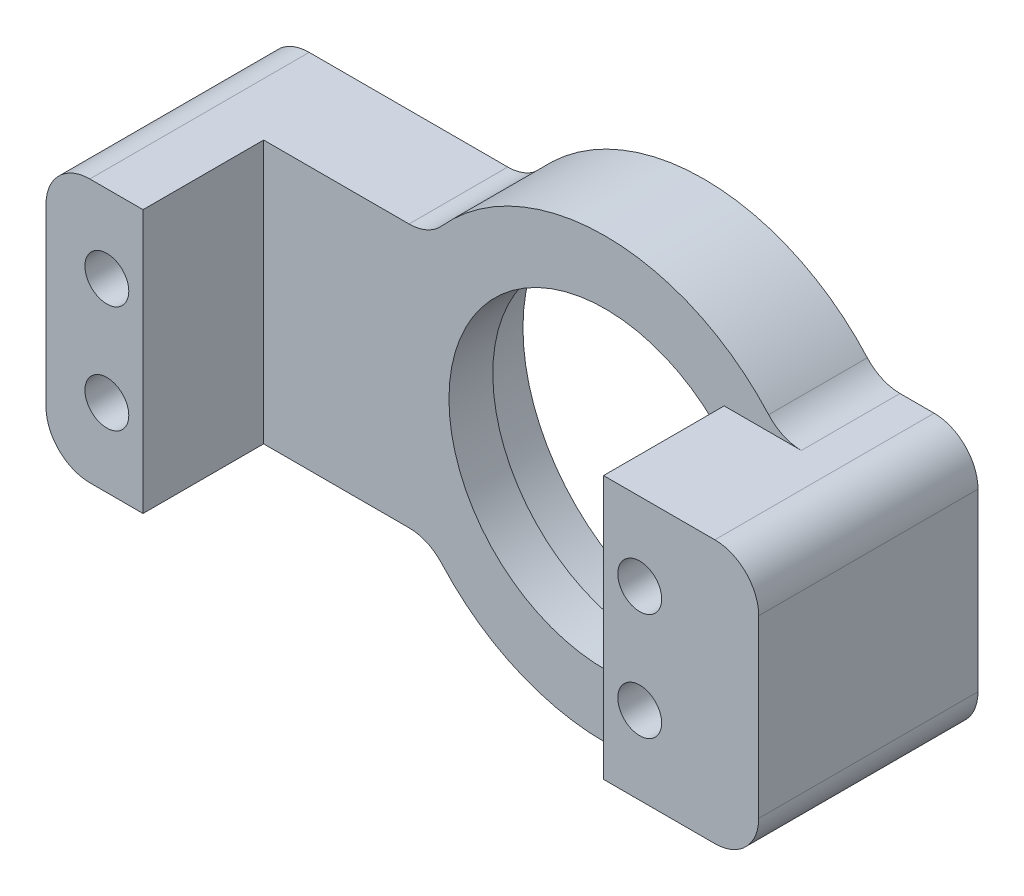
from build123d import *

# Parameters (mm, degrees)
SKETCH1_R           = 16.5
BOSS_EXTRUDE1_DEPTH = 5
SKETCH2_R           = 14.25
BOSS_EXTRUDE2_DEPTH = 4
SKETCH4_W           = 14.15
SKETCH4_H           = 24
SKETCH4_W_2         = 8.85
BOSS_EXTRUDE4_DEPTH = 11
FILLET1_R           = 4
SKETCH5_R           = 2
CUT_EXTRUDE1_DEPTH  = 4


with BuildPart() as part:
    # Sketch1 → Boss-Extrude1 (new body)
    with BuildSketch(Plane.XY):
        with BuildLine():
            Line((-40, 125.007283518), (-16, 125.007283518))
            ThreePointArc((-16, 125.007283518), (0, 133.007283518), (16, 125.007283518))
            Line((16, 125.007283518), (25, 125.007283518))
            Line((25, 125.007283518), (25, 101.007283518))
            Line((25, 101.007283518), (16, 101.007283518))
            ThreePointArc((16, 101.007283518), (0, 93.007283518), (-16, 101.007283518))
            Line((-16, 101.007283518), (-40, 101.007283518))
            Line((-40, 101.007283518), (-40, 125.007283518))
        make_face()
        with Locations((0, 113.007283518)):
            Circle(SKETCH1_R, mode=Mode.SUBTRACT)
    extrude(amount=BOSS_EXTRUDE1_DEPTH)

    # Sketch2 → Boss-Extrude2 (add)
    with BuildSketch(Plane.XY.offset(5)):
        with BuildLine():
            Line((-16, 125.007283518), (-40, 125.007283518))
            Line((-40, 125.007283518), (-40, 101.007283518))
            Line((-40, 101.007283518), (-16, 101.007283518))
            ThreePointArc((-16, 101.007283518), (0, 93.007283518), (16, 101.007283518))
            Line((16, 101.007283518), (25, 101.007283518))
            Line((25, 101.007283518), (25, 125.007283518))
            Line((25, 125.007283518), (16, 125.007283518))
            ThreePointArc((16, 125.007283518), (0, 133.007283518), (-16, 125.007283518))
        make_face()
        with Locations((0, 113.007283518)):
            Circle(SKETCH2_R, mode=Mode.SUBTRACT)
    extrude(amount=BOSS_EXTRUDE2_DEPTH)

    # Sketch4 → Boss-Extrude4 (add)
    with BuildSketch(Plane.XY.offset(9)):
        with Locations((17.925, 113.007283518)):
            Rectangle(SKETCH4_W, SKETCH4_H)
        with Locations((-35.575, 113.007283518)):
            Rectangle(SKETCH4_W_2, SKETCH4_H)
    extrude(amount=BOSS_EXTRUDE4_DEPTH)

    # Fillet1
    fillet1_edges = [part.edges().sort_by_distance(p)[0] for p in [
        (16, 125.007283518, 4.5),
        (-16, 125.007283518, 4.5),
        (-16, 101.007283518, 4.5),
        (16, 101.007283518, 4.5),
        (-40, 101.007283518, 10),
        (-40, 125.007283518, 10),
        (25, 125.007283518, 10),
        (25, 101.007283518, 10),
    ]]
    fillet(fillet1_edges, radius=FILLET1_R)

    # Sketch5 → Cut-Extrude1 (cut)
    with BuildSketch(Plane.XY.offset(20)):
        with Locations((-34.45, 108.107283518)):
            Circle(SKETCH5_R)
        with Locations((-34.45, 117.907283518)):
            Circle(SKETCH5_R)
        with Locations((14.15, 108.107283518)):
            Circle(SKETCH5_R)
        with Locations((14.15, 117.907283518)):
            Circle(SKETCH5_R)
    extrude(amount=-CUT_EXTRUDE1_DEPTH, mode=Mode.SUBTRACT)


solid = part.part
